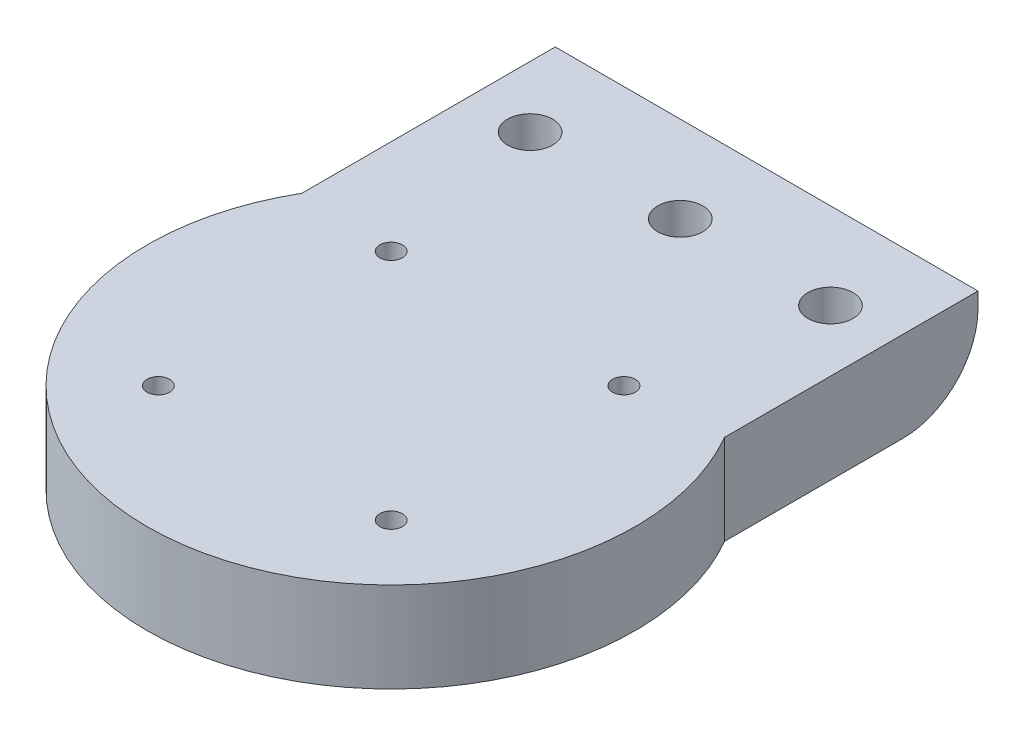
from build123d import *

# Parameters (mm, degrees)
SKETCH_1_R          = 32.5
SKETCH_1_R_2        = 1.5
EXTRUDE_2_DEPTH     = 12
SKETCH_2_R          = 5
EXTRUDE_3_DEPTH     = 12
EXTRUDE_START       = -12
EXTRUDE_4_DEPTH     = 12
SKETCH_4_R          = 3
CUT_EXTRUDE_1_DEPTH = 12
FILLET_2_R          = 10


with BuildPart() as part:
    # 草图1 → 凸台-拉伸2 (new body)
    with BuildSketch(Plane(origin=(0, 0, 0), x_dir=(1, 0, 0), z_dir=(0, 1, 0))):
        with Locations(Location((0, 0, 0), (0, 0, 270))):
            Circle(SKETCH_1_R)
        with Locations(Location((-15.5, 15.5, 0), (0, 0, 270))):
            Circle(SKETCH_1_R_2, mode=Mode.SUBTRACT)
        with Locations(Location((15.5, 15.5, 0), (0, 0, 270))):
            Circle(SKETCH_1_R_2, mode=Mode.SUBTRACT)
        with Locations(Location((15.5, -15.5, 0), (0, 0, 270))):
            Circle(SKETCH_1_R_2, mode=Mode.SUBTRACT)
        with Locations(Location((-15.5, -15.5, 0), (0, 0, 270))):
            Circle(SKETCH_1_R_2, mode=Mode.SUBTRACT)
    extrude(amount=EXTRUDE_2_DEPTH)

    # 草图2 → 凸台-拉伸3 (add)
    with BuildSketch(Plane.XZ):
        with Locations(Location((0, 0, 0), (0, 0, 90))):
            Circle(SKETCH_2_R)
    extrude(amount=EXTRUDE_3_DEPTH)

    # 草图3 → 凸台-拉伸4 (add)
    with BuildSketch(Plane(origin=(0, 12, 0), x_dir=(1, 0, 0), z_dir=(0, 1, 0)).offset(EXTRUDE_START)):
        with BuildLine():
            Line((-28.145825623, 50), (-28.145825623, 16.25))
            ThreePointArc((-28.145825623, 16.25), (-16.25, 28.145825623), (0, 32.5))
            Line((0, 32.5), (0, 50))
            Line((0, 50), (-28.145825623, 50))
        make_face()
        with BuildLine():
            ThreePointArc((0, 32.5), (16.25, 28.145825623), (28.145825623, 16.25))
            Line((28.145825623, 16.25), (28.145825623, 50))
            Line((28.145825623, 50), (0, 50))
            Line((0, 50), (0, 32.5))
        make_face()
    extrude(amount=EXTRUDE_4_DEPTH)

    # 草图4 → 切除-拉伸1 (cut)
    with BuildSketch(Plane(origin=(0, 12, 0), x_dir=(1, 0, 0), z_dir=(0, 1, 0))):
        with Locations(Location((0, 38.5, 0), (0, 0, 270))):
            Circle(SKETCH_4_R)
        with Locations(Location((20, 38.5, 0), (0, 0, 270))):
            Circle(SKETCH_4_R)
        with Locations(Location((-20, 38.5, 0), (0, 0, 270))):
            Circle(SKETCH_4_R)
    extrude(amount=-CUT_EXTRUDE_1_DEPTH, mode=Mode.SUBTRACT)

    # 圆角2
    # the kernel refuses this fillet: 10 mm, written as the material it takes off along each edge
    with BuildSketch(Plane(origin=(53.145825623, 0, -50), x_dir=(0, 0, 1), z_dir=(-1, 0, 0))) as fillet_2_piece_1:
        with BuildLine():
            CenterArc((FILLET_2_R, FILLET_2_R), FILLET_2_R, 180, 90)
            Line((0, FILLET_2_R), (0, 0))
            Line((0, 0), (FILLET_2_R, 0))
        make_face()
    extrude(amount=106.291651246, mode=Mode.SUBTRACT)


solid = part.part
